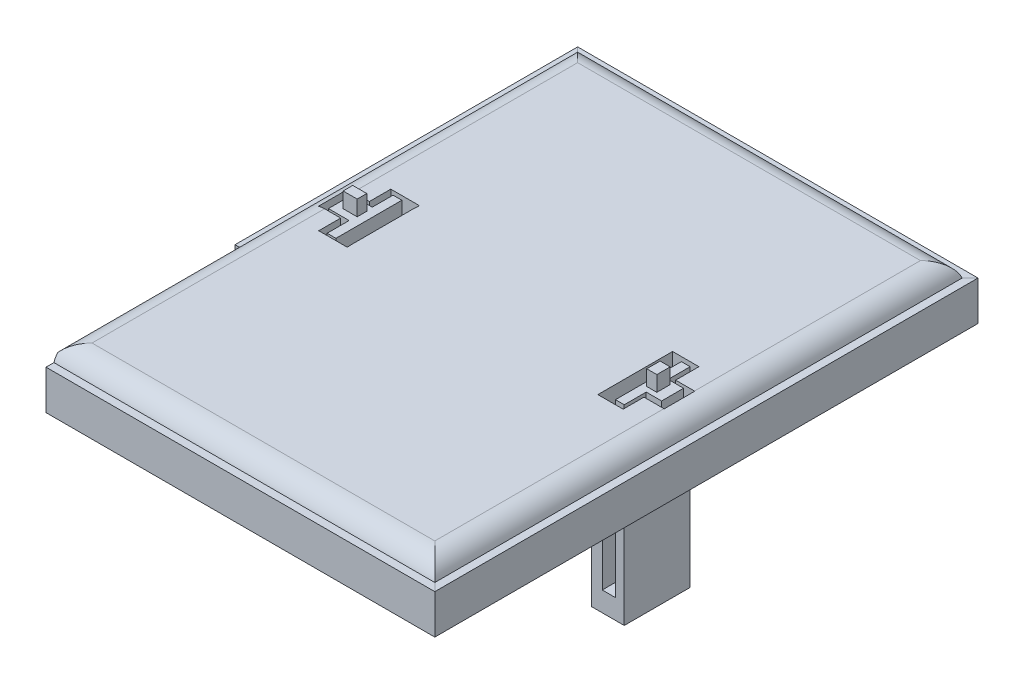
from build123d import *

# Parameters (mm, degrees)
STOCK_TOP_1_START                              = 44.45
STOCK_TOP_1_OUTLINE_W                          = 44.45
STOCK_TOP_1_OUTLINE_H                          = 60.96
STOCK_TOP_1_DEPTH                              = 2.54
STOCK_TOP_1_START_2                            = 43.942
STOCK_TOP_1_2_OUTLINE_W                        = 44.45
STOCK_TOP_1_2_OUTLINE_H                        = 60.96
STOCK_TOP_1_2_DEPTH                            = 0.508
OUTSIDE_FILLET_R                               = 2.54
CUT_A_BIT_OF_THE_ENCLOSURE_REACH               = 48.789
SKETCH1_W                                      = 1.334667882
SKETCH1_H                                      = 23.182275167
SKETCH2_W                                      = 3.81
SKETCH2_H                                      = 7.62
BATTERY_LID_1_DEPTH                            = 19.05
SKETCH3_W                                      = 2.54
SKETCH3_H                                      = 2.54
BATTERY_LID_HOLE_1_DEPTH                       = 1.778
CUT_EXTRUDE1_REACH                             = 64.264
SKETCH5_W                                      = 2.54
SKETCH5_H                                      = 2.54
BATTERY_LID_HOLE_2_DEPTH                       = 1.778
CUT_EXTRUDE2_REACH                             = 64.264
DETACH_LID_ATTACHEMENTS_REACH                  = 52.124
SKETCH9_W                                      = 1.524
SKETCH9_H                                      = 7.62
REMOVE_THE_INNARDS_OF_THE_LID_ATTACHMENT_DEPTH = 19.812
SKETCH11_W                                     = 1.167614697
SKETCH11_H                                     = 1.542617542
SKETCH11_W_2                                   = 1.626626063
SKETCH11_H_2                                   = 1.11023807
BOSS_EXTRUDE4_DEPTH                            = 1.778


# Read off the part's stored shape, not the designer's step: Stock-Top-1
with BuildPart() as part:
    # Stock-Top-1 outline → Stock-Top-1 (new body)
    with BuildSketch(Plane(origin=(0, 0, 0), x_dir=(1, 0, 0), z_dir=(0, 1, 0)).offset(STOCK_TOP_1_START)):
        with Locations((-1.821227893, 7.677651333)):
            Rectangle(STOCK_TOP_1_OUTLINE_W, STOCK_TOP_1_OUTLINE_H)
    extrude(amount=STOCK_TOP_1_DEPTH)

    # Stock-Top-1 2 outline → Stock-Top-1 2 (add)
    with BuildSketch(Plane(origin=(0, 0, 0), x_dir=(1, 0, 0), z_dir=(0, 1, 0)).offset(STOCK_TOP_1_START_2)):
        with Locations((-1.821227893, 7.677651333)):
            Rectangle(STOCK_TOP_1_2_OUTLINE_W, STOCK_TOP_1_2_OUTLINE_H)
        Polygon((11.494723241, -11.994444065), (17.863772107, -11.994444065), (17.863772107, -20.262348667), (-21.506227893, -20.262348667), (-21.506227893, -11.994444065), (-15.225663022, -11.994444065), (-15.225663022, 35.617651333), (11.494723241, 35.617651333), align=None, mode=Mode.SUBTRACT)
    extrude(amount=STOCK_TOP_1_2_DEPTH)

    # Enclosure: sweep along a path in Outline of Enclosure
    with BuildLine(Plane.XZ.offset(-43.942)) as enclosure_path:
        Line((-24.046227893, 22.802348667), (-24.046227893, -38.157651333))
        Line((-24.046227893, -38.157651333), (20.403772107, -38.157651333))
        Line((20.403772107, -38.157651333), (20.403772107, 22.802348667))
        Line((20.403772107, 22.802348667), (-24.046227893, 22.802348667))
    # Shape of Enclosure → Enclosure (sweep)
    with BuildSketch(Plane(origin=(20.403772107, 0, 0), x_dir=(0, 0, -1), z_dir=(1, 0, 0))):
        Polygon((38.157651333, 44.429907846), (38.442131333, 44.429907846), (38.442131333, 40.688820131), (39.070756728, 40.688820131), (39.070756728, 45.242521161), (38.157651333, 45.242521161), align=None)
    sweep(path=enclosure_path.line, transition=Transition.RIGHT)

    # Outside Fillet
    # the kernel refuses this fillet: 2.54 mm, written as the material it takes off along each edge
    with BuildSketch(Plane(origin=(20.403772107, 46.99, 28.835336218), x_dir=(2.8274047493178717e-10, -1.0, 0), z_dir=(0, 0, -1))) as outside_fillet_piece_1:
        with BuildLine():
            CenterArc((2.539999999, 2.413195021), OUTSIDE_FILLET_R, 180.000000016, 71.819221529)
            Line((-1e-09, 2.41319502), (-0.050800001, 2.41319502))
            Line((-0.050800001, 2.41319502), (-0.0508, 0))
            Line((-0.0508, 0), (0, -0.0508))
            ThreePointArc((0, -0.0508), (0.873739419, -0.0508), (1.731628415, -0.0482639))
            Line((1.731628415, -0.0482639), (1.747478839, 0))
        make_face()
    extrude(amount=73.025975102, mode=Mode.SUBTRACT)
    with BuildSketch(Plane(origin=(-24.046227893, 46.99, -44.190638886), x_dir=(2.827486071359672e-10, -1.0, 0), z_dir=(0, 0, 1))) as outside_fillet_piece_2:
        with BuildLine():
            CenterArc((2.540000001, 2.413195021), OUTSIDE_FILLET_R, 179.999999984, 71.819221529)
            Line((1e-09, 2.413195021), (-0.050799999, 2.413195021))
            Line((-0.050799999, 2.413195021), (-0.0508, 0))
            Line((-0.0508, 0), (0, -0.0508))
            ThreePointArc((0, -0.0508), (0.873739419, -0.0508), (1.731628415, -0.0482639))
            Line((1.731628415, -0.0482639), (1.747478839, 0))
        make_face()
    extrude(amount=73.025975107, mode=Mode.SUBTRACT)
    with BuildSketch(Plane(origin=(-30.079215446, 46.99, 22.802348667), x_dir=(0, -1.0, -1.349945893887387e-10), z_dir=(1, 0, 0))) as outside_fillet_piece_3:
        with BuildLine():
            CenterArc((2.54, 2.413195021), OUTSIDE_FILLET_R, 179.999999992, 71.819221529)
            Line((0, 2.413195021), (-0.0508, 2.413195021))
            Line((-0.0508, 2.413195021), (-0.0508, 0))
            Line((-0.0508, 0), (0, -0.0508))
            ThreePointArc((0, -0.0508), (0.873739419, -0.0508), (1.731628415, -0.0482639))
            Line((1.731628415, -0.0482639), (1.747478839, 0))
        make_face()
    extrude(amount=56.515975105, mode=Mode.SUBTRACT)
    with BuildSketch(Plane(origin=(26.436759659, 46.99, -38.157651333), x_dir=(0, 0, 1), z_dir=(-1, 0, 0))) as outside_fillet_piece_4:
        with BuildLine():
            CenterArc((2.413195021, -2.54), OUTSIDE_FILLET_R, 90, 71.819221529)
            Line((0, -1.747478839), (-0.048263901, -1.731628415))
            ThreePointArc((-0.048263901, -1.731628415), (-0.0508, -0.873739419), (-0.0508, 0))
            Line((-0.0508, 0), (0, 0.0508))
            Line((0, 0.0508), (2.413195021, 0.0508))
            Line((2.413195021, 0.0508), (2.413195021, 0))
        make_face()
    extrude(amount=56.515975103, mode=Mode.SUBTRACT)

    # Sketch1 → Cut a bit of the enclosure (cut, up to next)
    with BuildSketch(Plane.XZ.offset(-40.688820131), mode=Mode.PRIVATE) as cut_a_bit_of_the_enclosure_sk1:
        with Locations((-24.291999346, 12.124316479)):
            Rectangle(SKETCH1_W, SKETCH1_H)
    cut_a_bit_of_the_enclosure_tool1 = extrude(cut_a_bit_of_the_enclosure_sk1.sketch, amount=-CUT_A_BIT_OF_THE_ENCLOSURE_REACH, mode=Mode.PRIVATE) & part.part
    add(cut_a_bit_of_the_enclosure_tool1.solids().sort_by_distance((-24.291999, 40.68882, 12.124316))[0], mode=Mode.SUBTRACT)

    # Sketch2 → Battery lid 1 (add)
    with BuildSketch(Plane.XZ.offset(-43.942)):
        with Locations((-17.130663022, -8.001603634)):
            Rectangle(SKETCH2_W, SKETCH2_H)
        with Locations((13.399723241, -8.001603634)):
            Rectangle(SKETCH2_W, SKETCH2_H)
    extrude(amount=BATTERY_LID_1_DEPTH)

    # Sketch3 → Battery lid hole 1 (add)
    with BuildSketch(Plane.ZY.offset(19.035663022)):
        with Locations((-8.001603634, 37.592)):
            Rectangle(SKETCH3_W, SKETCH3_H)
    extrude(amount=BATTERY_LID_HOLE_1_DEPTH)

    # Sketch4 → Cut-Extrude1 (cut, up to next)
    with BuildSketch(Plane.XY.offset(-6.731603634), mode=Mode.PRIVATE) as cut_extrude1_sk1:
        Polygon((-20.813663022, 38.862), (-20.813663022, 36.322), (-19.924663022, 36.322), align=None)
    cut_extrude1_tool1 = extrude(cut_extrude1_sk1.sketch, amount=-CUT_EXTRUDE1_REACH, mode=Mode.PRIVATE) & part.part
    add(cut_extrude1_tool1.solids().sort_by_distance((-20.51733, 37.168667, -6.731604))[0], mode=Mode.SUBTRACT)

    # Sketch5 → Battery lid hole 2 (add)
    with BuildSketch(Plane(origin=(15.304723241, 0, 0), x_dir=(0, 0, -1), z_dir=(1, 0, 0))):
        with Locations((8.001603634, 37.592)):
            Rectangle(SKETCH5_W, SKETCH5_H)
    extrude(amount=BATTERY_LID_HOLE_2_DEPTH)

    # Sketch6 → Cut-Extrude2 (cut, up to next)
    with BuildSketch(Plane.XY.offset(-6.731603634), mode=Mode.PRIVATE) as cut_extrude2_sk1:
        Polygon((17.082723241, 38.862), (17.082723241, 36.322), (15.812723241, 36.322), align=None)
    cut_extrude2_tool1 = extrude(cut_extrude2_sk1.sketch, amount=-CUT_EXTRUDE2_REACH, mode=Mode.PRIVATE) & part.part
    add(cut_extrude2_tool1.solids().sort_by_distance((16.65939, 37.168667, -6.731604))[0], mode=Mode.SUBTRACT)

    # Sketch7 → Detach Lid attachements (cut, up to next)
    with BuildSketch(Plane.XZ.offset(-43.942), mode=Mode.PRIVATE) as detach_lid_attachements_sk1:
        Polygon((-16.469097924, -4.191603634), (-19.035663022, -4.191603634), (-19.035663022, -6.731603634), (-21.429165636, -6.731603634), (-21.429165636, -9.410456582), (-19.035663022, -9.410456582), (-19.035663022, -11.811603634), (-16.469097924, -11.811603634), (-16.469097924, -12.285051826), (-19.771097924, -12.285051826), (-19.771097924, -9.817750336), (-22.345673393, -9.817750336), (-22.345673393, -6.870456582), (-22.345673393, -6.492257022), (-19.771097924, -6.492257022), (-19.771097924, -3.953439546), (-16.469097924, -3.953439546), align=None)
    detach_lid_attachements_tool1 = extrude(detach_lid_attachements_sk1.sketch, amount=-DETACH_LID_ATTACHEMENTS_REACH, mode=Mode.PRIVATE) & part.part
    # Sketch7 → Detach Lid attachements (cut, up to next)
    with BuildSketch(Plane.XZ.offset(-43.942), mode=Mode.PRIVATE) as detach_lid_attachements_sk2:
        Polygon((12.764723241, -4.191603634), (15.304723241, -4.191603634), (15.304723241, -6.731603634), (17.082723241, -6.731603634), (17.082723241, -9.271603634), (15.304723241, -9.271603634), (15.304723241, -11.811603634), (12.764723241, -11.811603634), (12.764723241, -12.319603634), (15.812723241, -12.319603634), (15.812723241, -9.624506021), (18.02600878, -9.624506021), (18.02600878, -6.09262067), (15.685723241, -6.09262067), (15.685723241, -3.683603634), (12.764723241, -3.683603634), align=None)
    detach_lid_attachements_tool2 = extrude(detach_lid_attachements_sk2.sketch, amount=-DETACH_LID_ATTACHEMENTS_REACH, mode=Mode.PRIVATE) & part.part
    add(detach_lid_attachements_tool1.solids().sort_by_distance((-17.75238, 43.942, -4.089648))[0], mode=Mode.SUBTRACT)
    add(detach_lid_attachements_tool2.solids().sort_by_distance((14.034723, 43.942, -4.090479))[0], mode=Mode.SUBTRACT)

    # Sketch9 → Remove the innards of the lid attachment (cut)
    with BuildSketch(Plane(origin=(0, 46.99, 0), x_dir=(1, 0, 0), z_dir=(0, 1, 0))):
        with Locations((-17.257663022, 8.001603634)):
            Rectangle(SKETCH9_W, SKETCH9_H)
        with Locations((13.526723241, 8.001603634)):
            Rectangle(SKETCH9_W, SKETCH9_H)
    extrude(amount=-REMOVE_THE_INNARDS_OF_THE_LID_ATTACHMENT_DEPTH, mode=Mode.SUBTRACT)

    # Sketch11 → Boss-Extrude4 (add)
    with BuildSketch(Plane(origin=(0, 46.99, 0), x_dir=(1, 0, 0), z_dir=(0, 1, 0))):
        with Locations((15.362507718, 8.090206817)):
            Rectangle(SKETCH11_W, SKETCH11_H)
        with Locations((-19.754773261, 8.124447803)):
            Rectangle(SKETCH11_W_2, SKETCH11_H_2)
    extrude(amount=BOSS_EXTRUDE4_DEPTH)


solid = part.part
